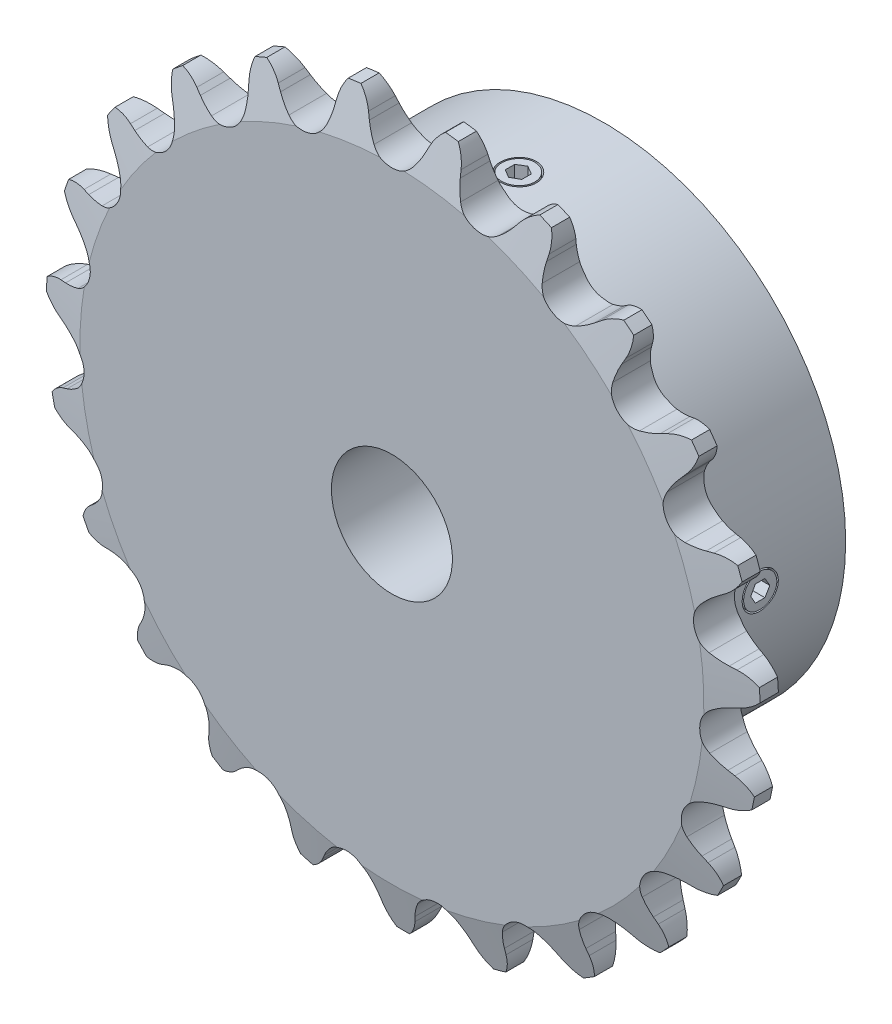
from build123d import *

# Parameters (mm, degrees)
TOOTH_CUT_NUMBER_OF_TEETH_23_DEPTH = 54.086682198
TOOTH_PATTERN_23_23_COUNT          = 23
SKETCH3_W                          = 17.9324
SKETCH3_H                          = 25.4
SKETCH4_R                          = 6.35
CUT_EXTRUDE1_DEPTH                 = 58.480181293
SKETCH5_W                          = 3.175
SKETCH5_H                          = 1.5875
CUT_EXTRUDE2_DEPTH                 = 58.480181293
SKETCH6_R                          = 1.5875
CUT_EXTRUDE3_DEPTH                 = 63.075117963
CUT_EXTRUDE3_DRAFT                 = 1
EXTRUDE1_REACH                     = 64.075
EXTRUDE1_END_RADIUS                = 25.4
SKETCH7_R                          = 1.741047324
CUT_EXTRUDE4_START                 = -2.54
CUT_EXTRUDE4_DEPTH                 = 60.535117996
CIRPATTERN1_START                  = 10.275861062
CIRPATTERN1_DEPTH                  = 15.124138938
EXTRUDE2_DEPTH                     = 22.225


# Read off the part's stored shape, not the designer's step: CirPattern1
with BuildPart() as part:
    # Sprocket-BaseSketch → 35 (06C) ANSI (ISO) Chain Number, 2.754in P.D. (revolve)
    with BuildSketch(Plane(origin=(0, 0, 0), x_dir=(0, 0, -1), z_dir=(1, 0, 0)), mode=Mode.PRIVATE) as f_35_06c_ansi_iso_chain_number_2_754i_sk:
        Polygon((2.1463, 0), (2.1463, 32.744760784), (0.955675, 37.507260784), (-0.955675, 37.507260784), (-2.1463, 32.744760784), (-2.1463, 0), align=None)
    revolve(f_35_06c_ansi_iso_chain_number_2_754i_sk.sketch.rotate(Axis((0, 0, -8.5852), (0, 0, 1)), 90), axis=Axis((0, 0, -8.5852), (0, 0, 1)))

    # Tooth-Sketch → Tooth-Cut, Number of teeth: 23 (cut, symmetric)
    with BuildSketch(Plane.XY):
        with BuildLine():
            Line((2.94884086, 34.958029854), (3.195121255, 35.56626595))
            ThreePointArc((3.195121255, 35.56626595), (4.723998622, 37.452076756), (7.045758448, 38.161428368))
            ThreePointArc((7.045758448, 38.161428368), (0, 38.806408326), (-7.045758448, 38.161428368))
            ThreePointArc((-7.045758448, 38.161428368), (-4.723998622, 37.452076756), (-3.195121255, 35.56626595))
            Line((-3.195121255, 35.56626595), (-2.94884086, 34.958029854))
            ThreePointArc((-2.94884086, 34.958029854), (-2.553810388, 34.145752037), (-2.052424075, 33.394449108))
            ThreePointArc((-2.052424075, 33.394449108), (0, 32.384724709), (2.052424075, 33.394449108))
            ThreePointArc((2.052424075, 33.394449108), (2.553810388, 34.145752037), (2.94884086, 34.958029854))
        make_face()
    tooth_cut_number_of_teeth_23 = extrude(amount=TOOTH_CUT_NUMBER_OF_TEETH_23_DEPTH, both=True, mode=Mode.SUBTRACT)

    # Tooth Pattern, 23 / 23: Tooth-Cut, Number of teeth: 23 ×23 about axis
    tooth_pattern_23_23_axis = Axis((0, 0, 0), (0, 0, 1))
    for i in range(1, TOOTH_PATTERN_23_23_COUNT):
        add(tooth_cut_number_of_teeth_23.rotate(tooth_pattern_23_23_axis, i * 360 / TOOTH_PATTERN_23_23_COUNT), mode=Mode.SUBTRACT)

    # Sketch3 → Hub-Revolve1 (revolve)
    with BuildSketch(Plane(origin=(0, 0, 0), x_dir=(0, 0, -1), z_dir=(1, 0, 0)), mode=Mode.PRIVATE) as hub_revolve1_sk:
        with Locations((11.1125, 12.7)):
            Rectangle(SKETCH3_W, SKETCH3_H)
    revolve(hub_revolve1_sk.sketch.rotate(Axis((0, 0, 17.9324), (0, 0, -1)), 90), axis=Axis((0, 0, 17.9324), (0, 0, -1)))

    # Sketch4 → Cut-Extrude1 (cut, through all)
    with BuildSketch(Plane(origin=(0, 0, -20.0787), x_dir=(-1, 0, 0), z_dir=(0, 0, -1))):
        Circle(SKETCH4_R)
    extrude(amount=-CUT_EXTRUDE1_DEPTH, mode=Mode.SUBTRACT)

    # Sketch5 → Cut-Extrude2 (cut, through all)
    with BuildSketch(Plane(origin=(0, 0, -20.0787), x_dir=(-1, 0, 0), z_dir=(0, 0, -1))):
        with Locations((0, 6.942111062)):
            Rectangle(SKETCH5_W, SKETCH5_H)
    extrude(amount=-CUT_EXTRUDE2_DEPTH, mode=Mode.SUBTRACT)


with BuildPart() as cut_extrude3_tool:
    # Sketch6 → Cut-Extrude3 (with draft: the straight prism first)
    with BuildSketch(Plane.XZ.offset(-7.735861062)):
        with Locations((0, -11.1125)):
            Circle(SKETCH6_R)
    extrude(amount=-CUT_EXTRUDE3_DEPTH)
    # Cut-Extrude3: the draft: its side faces are tilted about the plane it starts from
    cut_extrude3_sides = [cut_extrude3_tool.faces().sort_by_distance(p)[0] for p in [
        (-1.5875, 39.273420044, -11.1125),
    ]]
    draft(cut_extrude3_sides, Plane.XZ.offset(-7.735861062), CUT_EXTRUDE3_DRAFT)


with BuildPart() as part_1:
    add(part.part)

    # Cut-Extrude3: cut by cut_extrude3_tool
    add(cut_extrude3_tool.part, mode=Mode.SUBTRACT)

    # Extrude1: up to this cylinder (the profile starts inside it)
    extrude1_end = Plane(origin=(0, 0, -11.1125), z_dir=(0, 0, 1)) * Cylinder(EXTRUDE1_END_RADIUS, 179.95, mode=Mode.PRIVATE)
    # Sketch7 → Extrude1 (add, up to the surface)
    with BuildSketch(Plane.XZ.offset(-7.735861062), mode=Mode.PRIVATE) as extrude1_sk1:
        with Locations(Location((0, -11.1125, 0), (0, 0, 270))):
            Circle(SKETCH7_R)
    extrude1_tool1 = extrude(extrude1_sk1.sketch, amount=-EXTRUDE1_REACH, mode=Mode.PRIVATE) & extrude1_end
    add(extrude1_tool1.solids().sort_by_distance((0, 7.735861, -11.1125))[0])

    # Sketch8 → Cut-Extrude4 (cut, through all)
    with BuildSketch(Plane.XZ.offset(-7.735861062).offset(CUT_EXTRUDE4_START)):
        Polygon((0, -12.117694141), (0.870523662, -11.615097071), (0.870523662, -10.609902929), (0, -10.107305859), (-0.870523662, -10.609902929), (-0.870523662, -11.615097071), align=None)
    extrude(amount=-CUT_EXTRUDE4_DEPTH, mode=Mode.SUBTRACT)

    # CirPattern1 outline → CirPattern1 (cut)
    with BuildSketch(Plane.YZ.offset(CIRPATTERN1_START)):
        Polygon((-0.870523662, -11.615097071), (0, -12.117694141), (0.870523662, -11.615097071), (0.870523662, -10.609902929), (0, -10.107305859), (-0.870523662, -10.609902929), align=None)
    extrude(amount=CIRPATTERN1_DEPTH, mode=Mode.SUBTRACT)

    # CirPattern1 2 outline → CirPattern1 2 (revolve, cut)
    with BuildSketch(Plane.YX.offset(11.1125)):
        Polygon((1.741047324, 25.40000834), (1.741047324, 16.532581378), (1.895828695, 25.400000157), align=None)
    revolve(axis=Axis((0, 0, -11.1125), (1, 0, 0)), mode=Mode.SUBTRACT)

    # Sketch10 → Extrude2 (add)
    with BuildSketch(Plane(origin=(0, 0, -20.0787), x_dir=(-1, 0, 0), z_dir=(0, 0, -1))):
        with BuildLine():
            Line((-1.5875, 7.735861062), (-1.5875, 6.148361062))
            ThreePointArc((-1.5875, 6.148361062), (0, 6.35), (1.5875, 6.148361062))
            Line((1.5875, 6.148361062), (1.5875, 7.735861062))
            Line((1.5875, 7.735861062), (-1.5875, 7.735861062))
        make_face()
    extrude(amount=-EXTRUDE2_DEPTH)


solid = part_1.part
